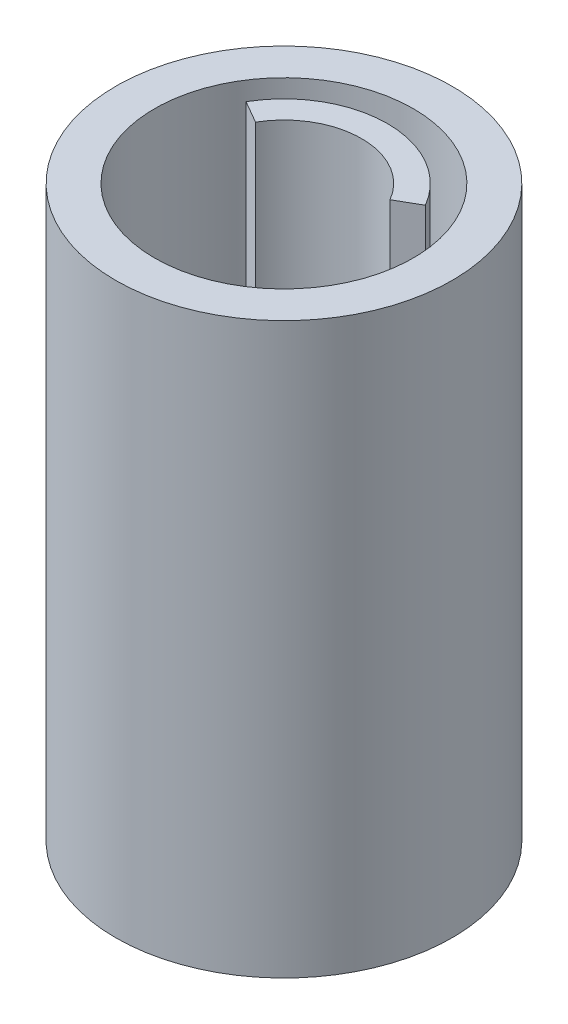
from build123d import *

# Parameters (mm, degrees)
SKETCH1_R           = 6.5
BOSS_EXTRUDE1_DEPTH = 22
CAVITY1_START       = 2
CAVITY1_OUTLINE_R   = 5
CAVITY1_OUTLINE_R_2 = 0.75
CAVITY1_DEPTH       = 20
CAVITY1_START_2     = 17
CAVITY1_2_OUTLINE_R = 0.75
CAVITY1_2_DEPTH     = 5
SKETCH2_R           = 0.5
CUT_EXTRUDE1_DEPTH  = 23.011360703
SKETCH3_R           = 0.3
CUT_EXTRUDE2_DEPTH  = 23.011360703


# Read off the part's stored shape, not the designer's step: Cavity1
with BuildPart() as part:
    # Sketch1 → Boss-Extrude1 (new body)
    with BuildSketch(Plane(origin=(0, 0, 0), x_dir=(1, 0, 0), z_dir=(0, 1, 0))):
        with Locations(Location((0, 0, 0), (0, 0, 270))):
            Circle(SKETCH1_R)
    extrude(amount=BOSS_EXTRUDE1_DEPTH)

    # Cavity1 outline → Cavity1 (cut)
    with BuildSketch(Plane(origin=(0, 0, 0), x_dir=(1, 0, 0), z_dir=(0, 1, 0)).offset(CAVITY1_START)):
        Circle(CAVITY1_OUTLINE_R)
        Circle(CAVITY1_OUTLINE_R_2, mode=Mode.SUBTRACT)
        with BuildLine():
            ThreePointArc((2.598076211, 1.5), (0, 3), (-2.598076211, 1.5))
            Line((-2.598076211, 1.5), (-3.464101615, 2))
            ThreePointArc((-3.464101615, 2), (0, 4), (3.464101615, 2))
            Line((3.464101615, 2), (2.598076211, 1.5))
        make_face(mode=Mode.SUBTRACT)
    extrude(amount=CAVITY1_DEPTH, mode=Mode.SUBTRACT)

    # Cavity1 2 outline → Cavity1 2 (cut)
    with BuildSketch(Plane(origin=(0, 0, 0), x_dir=(1, 0, 0), z_dir=(0, 1, 0)).offset(CAVITY1_START_2)):
        Circle(CAVITY1_2_OUTLINE_R)
    extrude(amount=CAVITY1_2_DEPTH, mode=Mode.SUBTRACT)

    # Sketch2 → Cut-Extrude1 (cut, through all)
    with BuildSketch(Plane(origin=(0, 2, 0), x_dir=(1, 0, 0), z_dir=(0, 1, 0))):
        with Locations(Location((0, -3, 0), (0, 0, 270))):
            Circle(SKETCH2_R)
        with Locations(Location((-2.897777479, -0.776457135, 0), (0, 0, 270))):
            Circle(SKETCH2_R)
        with Locations(Location((2.897777479, -0.776457135, 0), (0, 0, 90))):
            Circle(SKETCH2_R)
    extrude(amount=-CUT_EXTRUDE1_DEPTH, mode=Mode.SUBTRACT)

    # Sketch3 → Cut-Extrude2 (cut, through all)
    with BuildSketch(Plane(origin=(0, 2, 0), x_dir=(1, 0, 0), z_dir=(0, 1, 0))):
        with Locations(Location((0, 4.5, 0), (0, 0, 270))):
            Circle(SKETCH3_R)
        with Locations(Location((3.181980515, 3.181980515, 0), (0, 0, 270))):
            Circle(SKETCH3_R)
        with Locations(Location((-3.181980515, 3.181980515, 0), (0, 0, 90))):
            Circle(SKETCH3_R)
    extrude(amount=-CUT_EXTRUDE2_DEPTH, mode=Mode.SUBTRACT)


solid = part.part
